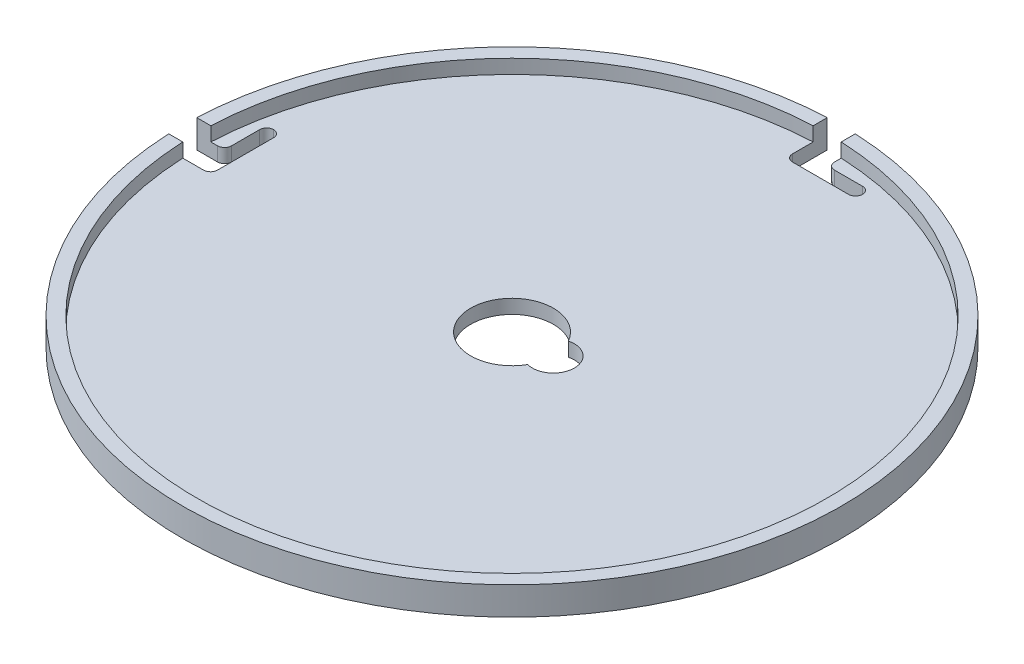
from build123d import *

# Parameters (mm, degrees)
SKETCH1_R                     = 45
OUTER_DISK_DEPTH              = 2
ENCLOSEMENT_T                 = 2
HOOK_RELEASE_DEPTH            = 67.498120274
CIRPATTERN1_COUNT             = 2
CIRPATTERN1_ANGLE             = 90
SERVO_MOTOR_CUTOUT_DEPTH      = 67.498120274
SERVO_MOTOR_CUTOUT_DEPTH_BACK = 67.498120274
SKETCH3_R                     = 3
SKETCH3_R_2                   = 5.9
FILLET1_R                     = 1


with BuildPart() as part:
    # Sketch1 → Outer DIsk (new body)
    with BuildSketch(Plane(origin=(0, 0, 0), x_dir=(1, 0, 0), z_dir=(0, 1, 0))):
        with Locations(Location((0, 0, 0), (0, 0, 270))):
            Circle(SKETCH1_R)
    extrude(amount=OUTER_DISK_DEPTH)

    # Enclosement
    enclosement_openings = [part.faces().sort_by_distance(p)[0] for p in [
        (0, 2, 0),
    ]]
    offset(amount=ENCLOSEMENT_T, openings=enclosement_openings, kind=Kind.INTERSECTION)

    # Sketch2 → Hook Release (cut, symmetric)
    with BuildSketch(Plane(origin=(0, 0, 0), x_dir=(1, 0, 0), z_dir=(0, 1, 0))):
        Polygon((-2, 47), (-2, 41), (8, 41), (8, 43), (2, 43), (2, 47), align=None)
    hook_release = extrude(amount=HOOK_RELEASE_DEPTH, both=True, mode=Mode.SUBTRACT)

    # CirPattern1: Hook Release ×2 about axis
    cirpattern1_axis = Axis((0, 0, 0), (0, 1, 0))
    for i in range(1, CIRPATTERN1_COUNT):
        add(hook_release.rotate(cirpattern1_axis, i * CIRPATTERN1_ANGLE / (CIRPATTERN1_COUNT - 1)), mode=Mode.SUBTRACT)

    # Sketch3 → Servo Motor Cutout (cut, two sides: drawn at the far end of the back side and taken through both)
    with BuildSketch(Plane(origin=(0, 0, 0), x_dir=(1, 0, 0), z_dir=(0, 1, 0)).offset(-SERVO_MOTOR_CUTOUT_DEPTH_BACK)):
        with Locations((5.9, 0)):
            Circle(SKETCH3_R)
        Circle(SKETCH3_R_2)
    extrude(amount=SERVO_MOTOR_CUTOUT_DEPTH + SERVO_MOTOR_CUTOUT_DEPTH_BACK, mode=Mode.SUBTRACT)

    # Fillet1
    fillet1_edges = [part.edges().sort_by_distance(p)[0] for p in [
        (-41, -1, 2),
        (-41, -1, -8),
        (-43, -1, -8),
        (-43, -1, -2),
        (8, -1, -41),
        (-2, -1, -41),
        (8, -1, -43),
        (2, -1, -43),
    ]]
    fillet(fillet1_edges, radius=FILLET1_R - 0.0001)  # a hair under: the kernel refuses the full size


solid = part.part
